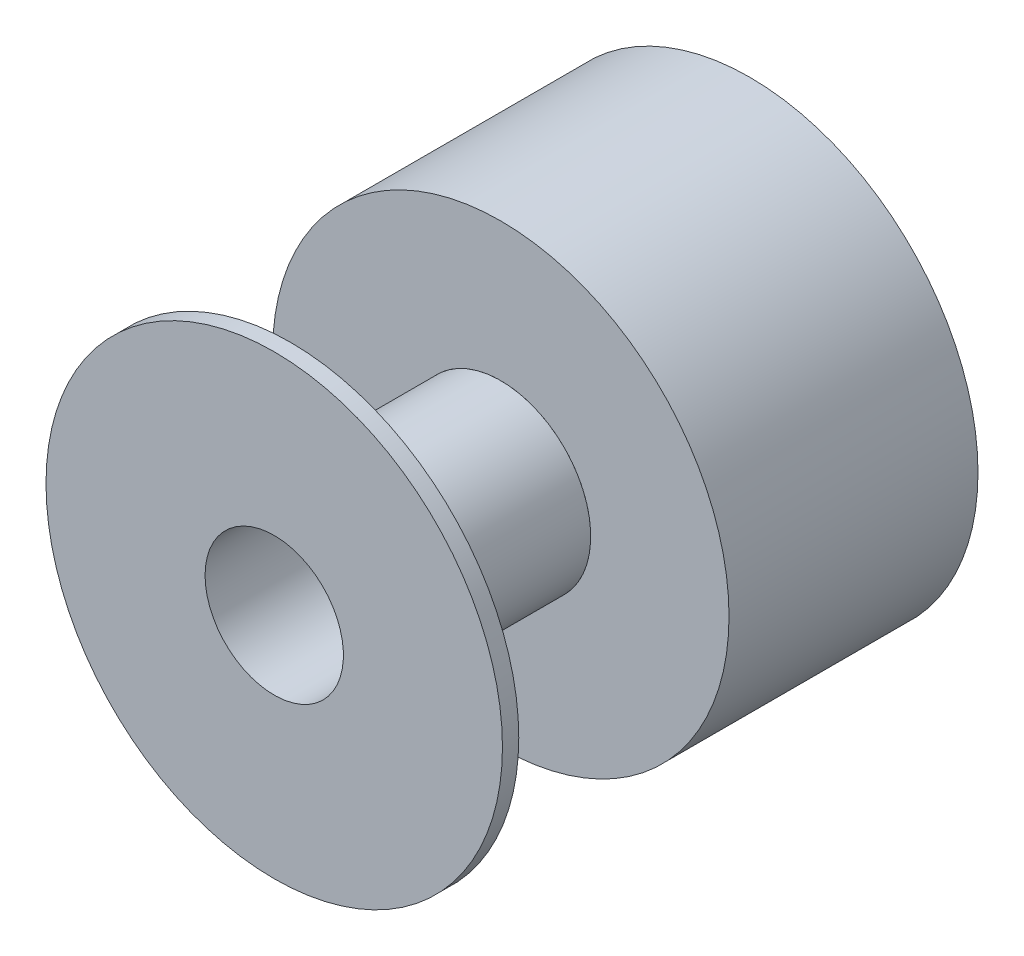
from build123d import *

# Parameters (mm, degrees)
SKETCH1_R           = 3.25
SKETCH1_R_2         = 2.5
BOSS_EXTRUDE1_DEPTH = 7.6
SKETCH1_3_R         = 8.25
SKETCH1_3_R_2       = 3.25
BOSS_EXTRUDE2_DEPTH = 9
SKETCH2_R           = 8.25
SKETCH2_R_2         = 2.5
BOSS_EXTRUDE3_DEPTH = 0.59


with BuildPart() as part:
    # Sketch1 → Boss-Extrude1 (new body)
    with BuildSketch(Plane.XY):
        Circle(SKETCH1_R)
        Circle(SKETCH1_R_2, mode=Mode.SUBTRACT)
    extrude(amount=BOSS_EXTRUDE1_DEPTH)

    # Sketch2 → Boss-Extrude3 (add)
    with BuildSketch(Plane.XY.offset(7.6)):
        Circle(SKETCH2_R)
        Circle(SKETCH2_R_2, mode=Mode.SUBTRACT)
    extrude(amount=BOSS_EXTRUDE3_DEPTH)


with BuildPart() as body_2:
    # Sketch1<3> → Boss-Extrude2 (new body)
    with BuildSketch(Plane.XY):
        Circle(SKETCH1_3_R)
        Circle(SKETCH1_3_R_2, mode=Mode.SUBTRACT)
    extrude(amount=-BOSS_EXTRUDE2_DEPTH)


solid = Compound([part.part, body_2.part])
